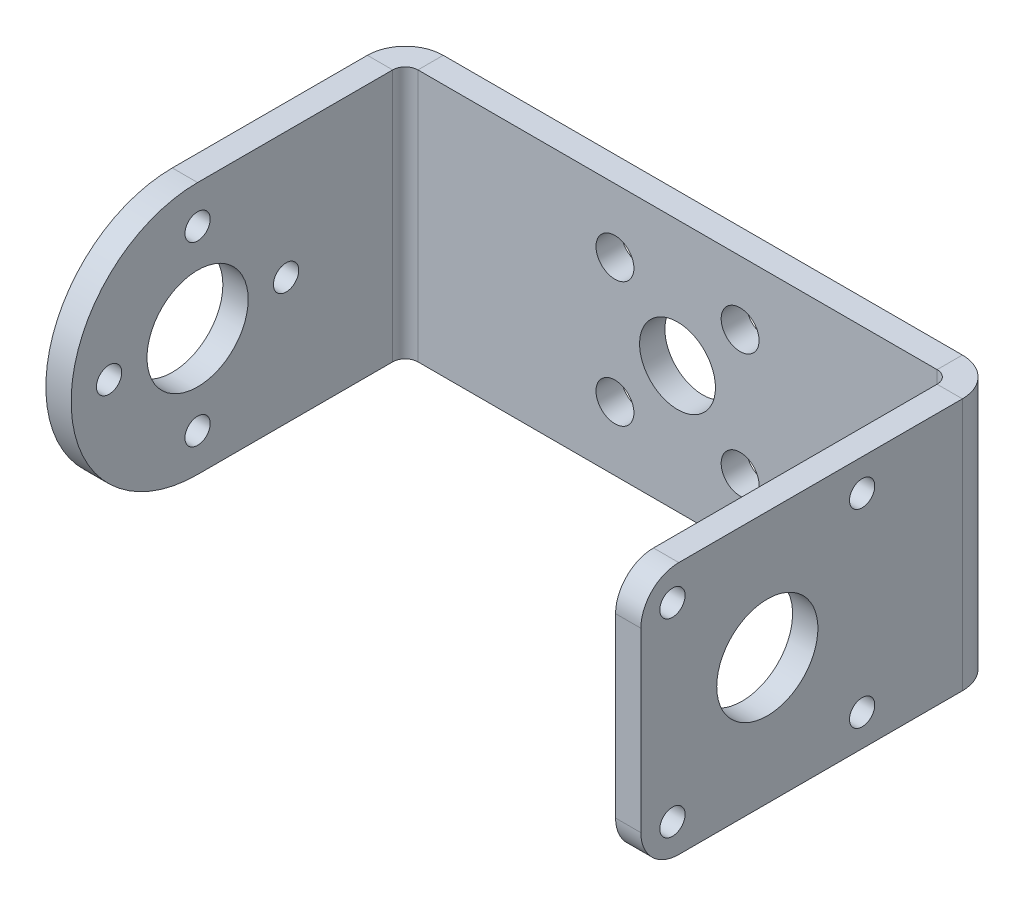
from build123d import *

# Parameters (mm, degrees)
IZIM1_R                      = 4
IZIM1_R_2                    = 1
IZIM1_R_3                    = 3
IZIM1_R_4                    = 1.5
TABAN_FLAN_2_DEPTH           = 2
IZGIDEN_START                = -1
IZGIDEN_B_KME2_OUTLINE_W     = 20
IZGIDEN_B_KME2_OUTLINE_H     = 2
IZGIDEN_B_KME2_DEPTH         = 26.570796327
IZGIDEN_START_2              = 72.629203673
IZGIDEN_B_KME2_2_OUTLINE_W   = 20
IZGIDEN_B_KME2_2_OUTLINE_H   = 2
IZGIDEN_B_KME2_2_DEPTH       = 25.570796327
IZGIDEN_START_3              = 25.570796327
IZGIDEN_B_KME2_3_OUTLINE_R   = 1
IZGIDEN_B_KME2_3_OUTLINE_R_2 = 4
IZGIDEN_B_KME2_3_DEPTH       = 3
IZGIDEN_START_4              = 69.629203673
IZGIDEN_B_KME2_4_OUTLINE_R   = 1
IZGIDEN_B_KME2_4_OUTLINE_R_2 = 4
IZGIDEN_B_KME2_4_DEPTH       = 3
IZGIDEN_START_5              = 70.629203673
IZGIDEN_B_KME2_5_OUTLINE_R   = 1
IZGIDEN_B_KME2_5_DEPTH       = 2
IZGIDEN_B_KME2_6_OUTLINE_R   = 1
IZGIDEN_B_KME2_6_DEPTH       = 2
IZGIDEN_START_6              = -21
IZGIDEN_B_KME2_7_DEPTH       = 22


with BuildPart() as part:
    # Taban-Flanş2: sheet metal written as solids
    # Çizim1 → Taban-Flanş2 (new body)
    with BuildSketch(Plane.XY):
        with BuildLine():
            Line((98.2, -3), (98.2, -17))
            ThreePointArc((98.2, -17), (97.321320344, -19.121320344), (95.2, -20))
            Line((95.2, -20), (10, -20))
            ThreePointArc((10, -20), (0, -10), (10, 0))
            Line((10, 0), (95.2, 0))
            ThreePointArc((95.2, 0), (97.321320344, -0.878679656), (98.2, -3))
        make_face()
        with Locations((10, -10)):
            Circle(IZIM1_R, mode=Mode.SUBTRACT)
        with Locations((10, -17)):
            Circle(IZIM1_R_2, mode=Mode.SUBTRACT)
        with Locations((3, -10)):
            Circle(IZIM1_R_2, mode=Mode.SUBTRACT)
        with Locations((10, -3)):
            Circle(IZIM1_R_2, mode=Mode.SUBTRACT)
        with Locations((17, -10)):
            Circle(IZIM1_R_2, mode=Mode.SUBTRACT)
        with Locations((88.2, -10)):
            Circle(IZIM1_R, mode=Mode.SUBTRACT)
        with Locations((80.7, -2.5)):
            Circle(IZIM1_R_2, mode=Mode.SUBTRACT)
        with Locations((95.7, -2.5)):
            Circle(IZIM1_R_2, mode=Mode.SUBTRACT)
        with Locations((95.7, -17.5)):
            Circle(IZIM1_R_2, mode=Mode.SUBTRACT)
        with Locations((80.7, -17.5)):
            Circle(IZIM1_R_2, mode=Mode.SUBTRACT)
        with Locations((49.1, -10)):
            Circle(IZIM1_R_3, mode=Mode.SUBTRACT)
        with Locations((54.05, -5.05)):
            Circle(IZIM1_R_4, mode=Mode.SUBTRACT)
        with Locations((44.15, -5.05)):
            Circle(IZIM1_R_4, mode=Mode.SUBTRACT)
        with Locations((44.15, -14.95)):
            Circle(IZIM1_R_4, mode=Mode.SUBTRACT)
        with Locations((54.05, -14.95)):
            Circle(IZIM1_R_4, mode=Mode.SUBTRACT)
    extrude(amount=-TABAN_FLAN_2_DEPTH)

    # Çizgiden Bükme2: read off the stored shape, not the designer's step
    # Çizgiden Bükme2 outline → Çizgiden Bükme2 (cut)
    with BuildSketch(Plane.YZ.offset(IZGIDEN_START)):
        with Locations((-10, -1)):
            Rectangle(IZGIDEN_B_KME2_OUTLINE_W, IZGIDEN_B_KME2_OUTLINE_H)
    extrude(amount=IZGIDEN_B_KME2_DEPTH, mode=Mode.SUBTRACT)

    # izgiden B_kme2 2 outline → izgiden B_kme2 2 (cut)
    with BuildSketch(Plane.YZ.offset(IZGIDEN_START_2)):
        with Locations((-10, -1)):
            Rectangle(IZGIDEN_B_KME2_2_OUTLINE_W, IZGIDEN_B_KME2_2_OUTLINE_H)
    extrude(amount=IZGIDEN_B_KME2_2_DEPTH, mode=Mode.SUBTRACT)

    # izgiden B_kme2 3 outline → izgiden B_kme2 3 (add)
    with BuildSketch(Plane.YZ.offset(IZGIDEN_START_3)):
        with BuildLine():
            Line((-20, 0), (0, 0))
            Line((0, 0), (0, 16.429203673))
            ThreePointArc((0, 16.429203673), (-0.620384974, 19.896597791), (-2.404564394, 22.933768067))
            ThreePointArc((-2.404564394, 22.933768067), (-3.207106781, 23.222096892), (-3.495435606, 24.024639279))
            ThreePointArc((-3.495435606, 24.024639279), (-10, 26.429203673), (-16.504564394, 24.024639279))
            ThreePointArc((-16.504564394, 24.024639279), (-16.792893219, 23.222096892), (-17.595435606, 22.933768067))
            ThreePointArc((-17.595435606, 22.933768067), (-19.379615026, 19.896597791), (-20, 16.429203673))
            Line((-20, 16.429203673), (-20, 0))
        make_face()
        with Locations((-17.5, 8.929203673)):
            Circle(IZGIDEN_B_KME2_3_OUTLINE_R, mode=Mode.SUBTRACT)
        with Locations((-10, 9.429203673)):
            Circle(IZGIDEN_B_KME2_3_OUTLINE_R, mode=Mode.SUBTRACT)
        with Locations((-2.5, 8.929203673)):
            Circle(IZGIDEN_B_KME2_3_OUTLINE_R, mode=Mode.SUBTRACT)
        with Locations((-17, 16.429203673)):
            Circle(IZGIDEN_B_KME2_3_OUTLINE_R, mode=Mode.SUBTRACT)
        with Locations((-10, 16.429203673)):
            Circle(IZGIDEN_B_KME2_3_OUTLINE_R_2, mode=Mode.SUBTRACT)
        with Locations((-3, 16.429203673)):
            Circle(IZGIDEN_B_KME2_3_OUTLINE_R, mode=Mode.SUBTRACT)
        with Locations((-10, 23.429203673)):
            Circle(IZGIDEN_B_KME2_3_OUTLINE_R, mode=Mode.SUBTRACT)
    extrude(amount=IZGIDEN_B_KME2_3_DEPTH)

    # izgiden B_kme2 4 outline → izgiden B_kme2 4 (add)
    with BuildSketch(Plane.YZ.offset(IZGIDEN_START_4)):
        with BuildLine():
            Line((-20, 0), (0, 0))
            Line((0, 0), (0, 16.429203673))
            ThreePointArc((0, 16.429203673), (-0.620384974, 19.896597791), (-2.404564394, 22.933768067))
            ThreePointArc((-2.404564394, 22.933768067), (-3.207106781, 23.222096892), (-3.495435606, 24.024639279))
            ThreePointArc((-3.495435606, 24.024639279), (-10, 26.429203673), (-16.504564394, 24.024639279))
            ThreePointArc((-16.504564394, 24.024639279), (-16.792893219, 23.222096892), (-17.595435606, 22.933768067))
            ThreePointArc((-17.595435606, 22.933768067), (-19.379615026, 19.896597791), (-20, 16.429203673))
            Line((-20, 16.429203673), (-20, 0))
        make_face()
        with Locations((-17.5, 8.929203673)):
            Circle(IZGIDEN_B_KME2_4_OUTLINE_R, mode=Mode.SUBTRACT)
        with Locations((-10, 9.429203673)):
            Circle(IZGIDEN_B_KME2_4_OUTLINE_R, mode=Mode.SUBTRACT)
        with Locations((-2.5, 8.929203673)):
            Circle(IZGIDEN_B_KME2_4_OUTLINE_R, mode=Mode.SUBTRACT)
        with Locations((-17, 16.429203673)):
            Circle(IZGIDEN_B_KME2_4_OUTLINE_R, mode=Mode.SUBTRACT)
        with Locations((-10, 16.429203673)):
            Circle(IZGIDEN_B_KME2_4_OUTLINE_R_2, mode=Mode.SUBTRACT)
        with Locations((-3, 16.429203673)):
            Circle(IZGIDEN_B_KME2_4_OUTLINE_R, mode=Mode.SUBTRACT)
        with Locations((-10, 23.429203673)):
            Circle(IZGIDEN_B_KME2_4_OUTLINE_R, mode=Mode.SUBTRACT)
    extrude(amount=IZGIDEN_B_KME2_4_DEPTH)

    # izgiden B_kme2 5 outline → izgiden B_kme2 5 (add)
    with BuildSketch(Plane.YZ.offset(IZGIDEN_START_5)):
        with BuildLine():
            ThreePointArc((-2.404564394, 22.933768067), (-0.620384974, 19.896597791), (0, 16.429203673))
            Line((0, 16.429203673), (0, 23.429203673))
            ThreePointArc((0, 23.429203673), (-0.878679656, 25.550524017), (-3, 26.429203673))
            Line((-3, 26.429203673), (-10, 26.429203673))
            ThreePointArc((-10, 26.429203673), (-6.532605882, 25.808818699), (-3.495435606, 24.024639279))
            ThreePointArc((-3.495435606, 24.024639279), (-1.792893219, 24.636310454), (-2.404564394, 22.933768067))
        make_face()
        with BuildLine():
            Line((-20, 23.429203673), (-20, 16.429203673))
            ThreePointArc((-20, 16.429203673), (-19.379615026, 19.896597791), (-17.595435606, 22.933768067))
            ThreePointArc((-17.595435606, 22.933768067), (-18.207106781, 24.636310454), (-16.504564394, 24.024639279))
            ThreePointArc((-16.504564394, 24.024639279), (-13.467394118, 25.808818699), (-10, 26.429203673))
            Line((-10, 26.429203673), (-17, 26.429203673))
            ThreePointArc((-17, 26.429203673), (-19.121320344, 25.550524017), (-20, 23.429203673))
        make_face()
        with Locations((-17, 16.429203673)):
            Circle(IZGIDEN_B_KME2_5_OUTLINE_R)
        with Locations((-10, 23.429203673)):
            Circle(IZGIDEN_B_KME2_5_OUTLINE_R)
        with Locations((-3, 16.429203673)):
            Circle(IZGIDEN_B_KME2_5_OUTLINE_R)
        with Locations((-10, 9.429203673)):
            Circle(IZGIDEN_B_KME2_5_OUTLINE_R)
    extrude(amount=IZGIDEN_B_KME2_5_DEPTH)

    # izgiden B_kme2 6 outline → izgiden B_kme2 6 (add)
    with BuildSketch(Plane.YZ.offset(IZGIDEN_START_3)):
        with BuildLine():
            ThreePointArc((-3.495435606, 24.024639279), (-3.207106781, 23.222096892), (-2.404564394, 22.933768067))
            ThreePointArc((-2.404564394, 22.933768067), (-2.928932188, 23.500271485), (-3.495435606, 24.024639279))
        make_face()
        with BuildLine():
            ThreePointArc((-16.504564394, 24.024639279), (-17.071067812, 23.500271485), (-17.595435606, 22.933768067))
            ThreePointArc((-17.595435606, 22.933768067), (-16.792893219, 23.222096892), (-16.504564394, 24.024639279))
        make_face()
        with Locations((-2.5, 8.929203673)):
            Circle(IZGIDEN_B_KME2_6_OUTLINE_R)
        with Locations((-17.5, 8.929203673)):
            Circle(IZGIDEN_B_KME2_6_OUTLINE_R)
    extrude(amount=IZGIDEN_B_KME2_6_DEPTH)

    # izgiden B_kme2 7 outline → izgiden B_kme2 7 (cut)
    with BuildSketch(Plane(origin=(0, 0, 0), x_dir=(1, 0, 0), z_dir=(0, 1, 0)).offset(IZGIDEN_START_6)):
        with BuildLine():
            ThreePointArc((25.570796327, -1), (26.449475983, 1.121320344), (28.570796327, 2))
            Line((28.570796327, 2), (25.570796327, 1.999999978))
            Line((25.570796327, 1.999999978), (25.570796327, -1))
        make_face()
        with BuildLine():
            Line((72.629203673, 1.999999978), (69.629203673, 2))
            ThreePointArc((69.629203673, 2), (71.750524017, 1.121320344), (72.629203673, -1))
            Line((72.629203673, -1), (72.629203673, 1.999999978))
        make_face()
        with BuildLine():
            Line((27.570796327, -1), (27.570796327, -28))
            Line((27.570796327, -28), (28.570796327, -28))
            Line((28.570796327, -28), (28.570796327, 0))
            ThreePointArc((28.570796327, 0), (27.863689546, -0.292893219), (27.570796327, -1))
        make_face()
        with BuildLine():
            Line((69.629203673, -28), (70.629203673, -28))
            Line((70.629203673, -28), (70.629203673, -1))
            ThreePointArc((70.629203673, -1), (70.336310454, -0.292893219), (69.629203673, 0))
            Line((69.629203673, 0), (69.629203673, -28))
        make_face()
    extrude(amount=IZGIDEN_B_KME2_7_DEPTH, mode=Mode.SUBTRACT)


solid = part.part
